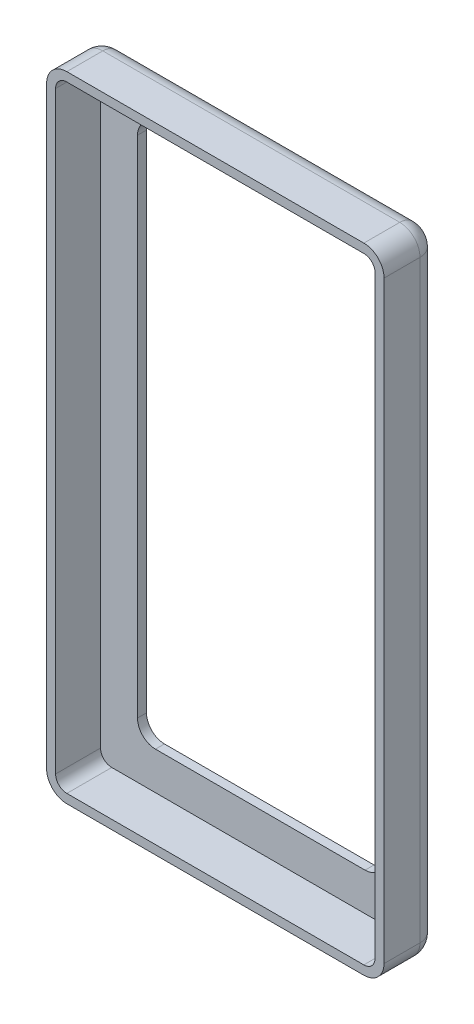
from build123d import *

# Parameters (mm, degrees)
BOSS_EXTRU_1_DEPTH      = 10
COQUE1_T                = 2
CONG_1_R                = 4
ENL_V_MAT_EXTRU_1_DEPTH = 10


with BuildPart() as part:
    # Esquisse1 → Boss.-Extru.1 (new body)
    with BuildSketch(Plane.XY):
        with BuildLine():
            Line((-33.546223224, -67.598576794), (32.573776776, -67.598576794))
            ThreePointArc((32.573776776, -67.598576794), (34.341543729, -66.866343747), (35.073776776, -65.098576794))
            Line((35.073776776, -65.098576794), (35.073776776, 67.061423206))
            ThreePointArc((35.073776776, 67.061423206), (34.341543729, 68.829190159), (32.573776776, 69.561423206))
            Line((32.573776776, 69.561423206), (-33.546223224, 69.561423206))
            ThreePointArc((-33.546223224, 69.561423206), (-35.313990177, 68.829190159), (-36.046223224, 67.061423206))
            Line((-36.046223224, 67.061423206), (-36.046223224, -65.098576794))
            ThreePointArc((-36.046223224, -65.098576794), (-35.313990177, -66.866343747), (-33.546223224, -67.598576794))
        make_face()
    extrude(amount=BOSS_EXTRU_1_DEPTH)

    # Coque1
    coque1_openings = [part.faces().sort_by_distance(p)[0] for p in [
        (-0.486223224, 0.981423206, 10),
    ]]
    offset(amount=COQUE1_T, openings=coque1_openings, kind=Kind.INTERSECTION)

    # Congé1
    # the kernel refuses this fillet: 4 mm, written as the material it takes off along each edge
    with BuildSketch(Plane(origin=(32.573776776, 71.561423206, -2), x_dir=(0, 0, 1), z_dir=(-1, 0, 0)), Plane(origin=(-33.546223224, -69.598576794, -2), x_dir=(0, 0, 1), z_dir=(1, 0, 0))) as cong_1_piece_1:
        with BuildLine():
            CenterArc((CONG_1_R, -CONG_1_R), CONG_1_R, 90, 90)
            Line((0, -CONG_1_R), (0, 0))
            Line((0, 0), (CONG_1_R, 0))
        make_face()
    extrude(amount=66.12, mode=Mode.SUBTRACT)
    with BuildSketch(Plane(origin=(32.573776776, 67.061423206, -2), x_dir=(0, 1, 0), z_dir=(-1, 0, 0))) as cong_1_piece_2:
        with BuildLine():
            CenterArc((4.5 - CONG_1_R, -CONG_1_R), CONG_1_R, 0, 90)
            Line((4.5 - CONG_1_R, 0), (4.5, 0))
            Line((4.5, 0), (4.5, -CONG_1_R))
        make_face()
    revolve(axis=Axis((32.573776776, 67.061423206, -2), (0, 0, -1)), revolution_arc=90, mode=Mode.SUBTRACT)
    with BuildSketch(Plane(origin=(37.073776776, -65.098576794, -2), x_dir=(0, 0, 1), z_dir=(0, 1, 0)), Plane(origin=(-38.046223224, 67.061423206, -2), x_dir=(0, 0, 1), z_dir=(0, -1, 0))) as cong_1_piece_3:
        with BuildLine():
            CenterArc((CONG_1_R, -CONG_1_R), CONG_1_R, 90, 90)
            Line((0, -CONG_1_R), (0, 0))
            Line((0, 0), (CONG_1_R, 0))
        make_face()
    extrude(amount=132.16, mode=Mode.SUBTRACT)
    with BuildSketch(Plane(origin=(32.573776776, -65.098576794, -2), x_dir=(1, 0, 0), z_dir=(0, 1, 0))) as cong_1_piece_4:
        with BuildLine():
            CenterArc((4.5 - CONG_1_R, -CONG_1_R), CONG_1_R, 0, 90)
            Line((4.5 - CONG_1_R, 0), (4.5, 0))
            Line((4.5, 0), (4.5, -CONG_1_R))
        make_face()
    revolve(axis=Axis((32.573776776, -65.098576794, -2), (0, 0, -1)), revolution_arc=90, mode=Mode.SUBTRACT)
    with BuildSketch(Plane(origin=(-33.546223224, -65.098576794, -2), x_dir=(0, -1, 0), z_dir=(1, 0, 0))) as cong_1_piece_5:
        with BuildLine():
            CenterArc((4.5 - CONG_1_R, -CONG_1_R), CONG_1_R, 0, 90)
            Line((4.5 - CONG_1_R, 0), (4.5, 0))
            Line((4.5, 0), (4.5, -CONG_1_R))
        make_face()
    revolve(axis=Axis((-33.546223224, -65.098576794, -2), (0, 0, -1)), revolution_arc=90, mode=Mode.SUBTRACT)
    with BuildSketch(Plane(origin=(-33.546223224, 67.061423206, -2), x_dir=(-1, 0, 0), z_dir=(0, -1, 0))) as cong_1_piece_6:
        with BuildLine():
            CenterArc((4.5 - CONG_1_R, -CONG_1_R), CONG_1_R, 0, 90)
            Line((4.5 - CONG_1_R, 0), (4.5, 0))
            Line((4.5, 0), (4.5, -CONG_1_R))
        make_face()
    revolve(axis=Axis((-33.546223224, 67.061423206, -2), (0, 0, -1)), revolution_arc=90, mode=Mode.SUBTRACT)

    # Esquisse2 → Enlèv. mat.-Extru.1 (cut)
    with BuildSketch(Plane(origin=(0, 0, -2), x_dir=(-1, 0, 0), z_dir=(0, 0, -1))):
        with BuildLine():
            Line((-22.841530632, -59.197056867), (23.81397708, -59.197056867))
            ThreePointArc((23.81397708, -59.197056867), (26.642404205, -58.025483992), (27.81397708, -55.197056867))
            Line((27.81397708, -55.197056867), (27.81397708, 57.159903279))
            ThreePointArc((27.81397708, 57.159903279), (26.642404205, 59.988330404), (23.81397708, 61.159903279))
            Line((23.81397708, 61.159903279), (-22.841530632, 61.159903279))
            ThreePointArc((-22.841530632, 61.159903279), (-25.669957756, 59.988330404), (-26.841530632, 57.159903279))
            Line((-26.841530632, 57.159903279), (-26.841530632, -55.197056867))
            ThreePointArc((-26.841530632, -55.197056867), (-25.669957756, -58.025483992), (-22.841530632, -59.197056867))
        make_face()
    extrude(amount=-ENL_V_MAT_EXTRU_1_DEPTH, mode=Mode.SUBTRACT)


solid = part.part
